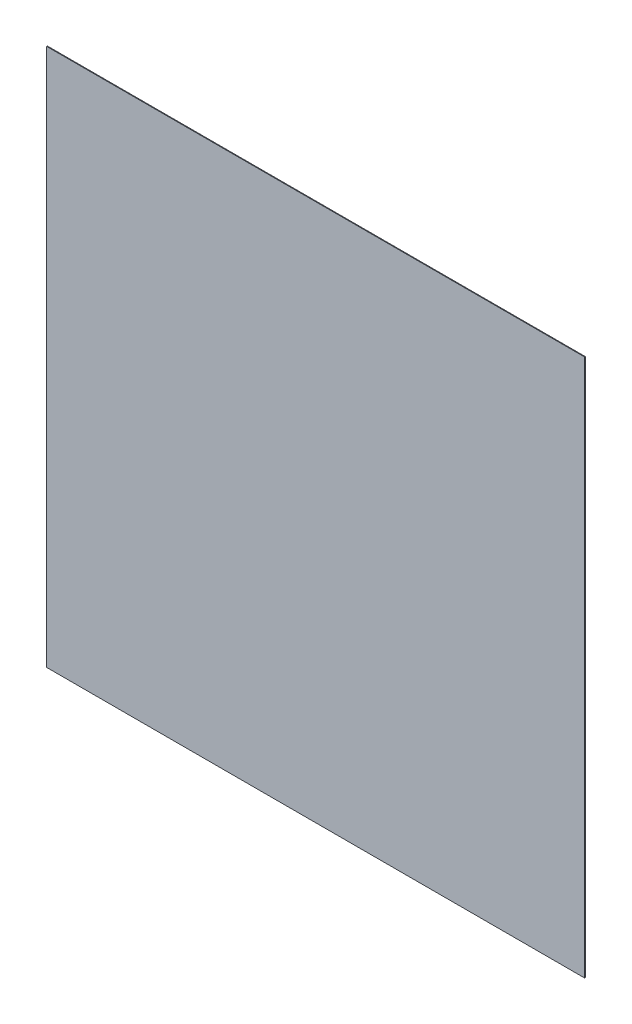
from build123d import *

# Parameters (mm, degrees)
SKETCH1_W           = 76.2
SKETCH1_H           = 76.2
BOSS_EXTRUDE1_DEPTH = 0.1


with BuildPart() as part:
    # Sketch1 → Boss-Extrude1 (new body)
    with BuildSketch(Plane.XY):
        Rectangle(SKETCH1_W, SKETCH1_H)
    extrude(amount=BOSS_EXTRUDE1_DEPTH)


solid = part.part
